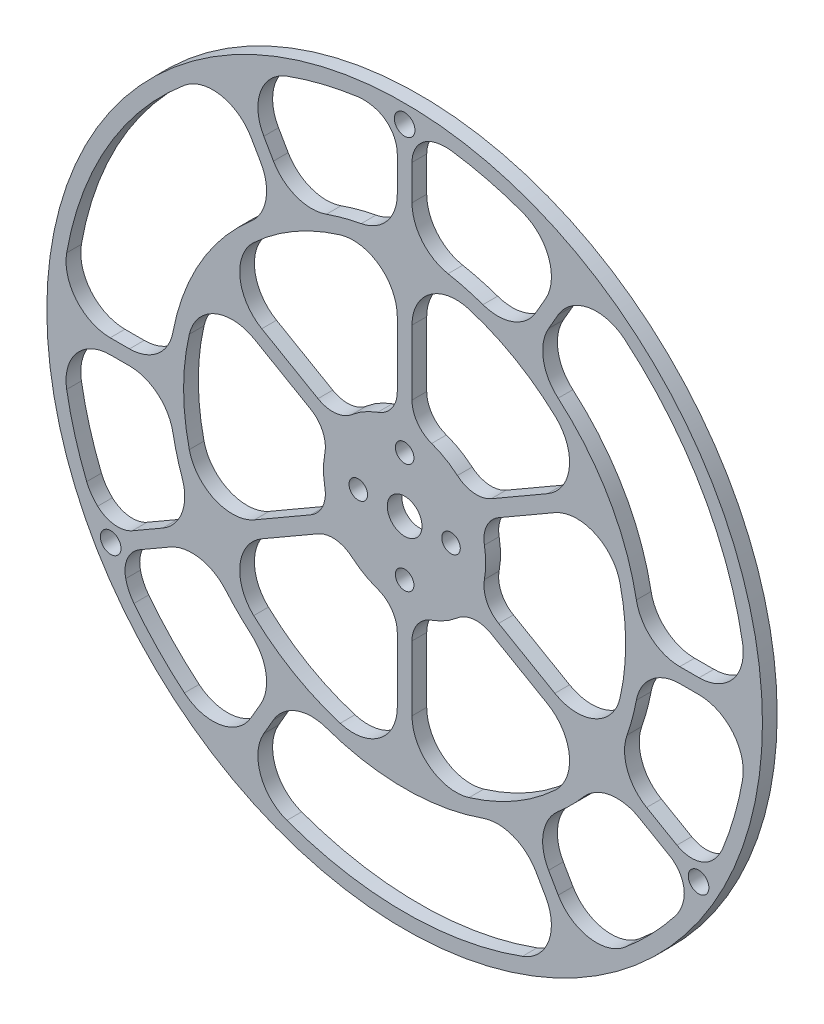
from build123d import *

# Parameters (mm, degrees)
SKETCH1_R               = 61.722
SKETCH1_R_2             = 59.182
SKETCH1_R_3             = 40.67
SKETCH1_R_4             = 38.13
SKETCH1_W               = 2.54
SKETCH1_H               = 25.4
EXTRUDE_THIN1_DEPTH     = 2.54
SKETCH1_14_R            = 1.778
SKETCH1_14_R_2          = 14
SKETCH1_14_R_3          = 3
SKETCH1_14_R_4          = 1.6
BOSS_EXTRUDE1_DEPTH     = 2.54
SKETCH2_W               = 2.54
SKETCH2_H               = 42.642
EXTRUDE_THIN3_DEPTH     = 2.54
CUT_EXTRUDE2_DEPTH      = 88.325037463
CUT_EXTRUDE2_DEPTH_BACK = 2.54
SKETCH1_16_R            = 1.778
FILLET1_DEPTH           = 2.54
SKETCH3_W               = 2.54
SKETCH3_H               = 3.122719577
BOSS_EXTRUDE2_DEPTH     = 2.54
FILLET2_R               = 5.08


with BuildPart() as part:
    # Sketch1 → Extrude-Thin1 (new body)
    # profile 1 of 13: a face of its own
    with BuildSketch(Plane.XY):
        Circle(SKETCH1_R)
        Circle(SKETCH1_R_2, mode=Mode.SUBTRACT)
    # profile 2 of 13: a face of its own
    with BuildSketch(Plane.XY):
        Circle(SKETCH1_R_3)
        Circle(SKETCH1_R_4, mode=Mode.SUBTRACT)
    # profile 3 of 13: a face of its own
    with BuildSketch(Plane.XY):
        Polygon((12.759355653, 5.900147737), (34.756400909, 18.600147737), (33.486400909, 20.799852263), (11.489355653, 8.099852263), align=None)
    # profile 4 of 13: a face of its own
    with BuildSketch(Plane.XY):
        with Locations((0, -26.7)):
            Rectangle(SKETCH1_W, SKETCH1_H)
    # profile 5 of 13: a face of its own
    with BuildSketch(Plane.XY):
        Polygon((-12.759355653, -5.900147737), (-49.688410921, -27.221147737), (-48.418410921, -29.420852263), (-11.489355653, -8.099852263), align=None)
    # profile 6 of 13: a face of its own
    with BuildSketch(Plane.XY):
        Polygon((-11.489355653, 8.099852263), (-33.486400909, 20.799852263), (-34.756400909, 18.600147737), (-12.759355653, 5.900147737), align=None)
    # profile 7 of 13: a face of its own
    with BuildSketch(Plane.XY):
        Polygon((20.804229626, 33.484213548), (31.32599957, 51.718222922), (29.12600043, 52.987712498), (18.604230486, 34.753703124), align=None)
    # profile 8 of 13: a face of its own
    with BuildSketch(Plane.XY):
        Polygon((39.400294371, -1.274884588), (60.452294674, -1.269999966), (60.451705326, 1.269999966), (39.399705024, 1.265115343), align=None)
    # profile 9 of 13: a face of its own
    with BuildSketch(Plane.XY):
        Polygon((18.596064745, -34.759098136), (29.126295104, -52.988222887), (31.325704896, -51.717712532), (20.795474538, -33.48858778), align=None)
    # profile 10 of 13: a face of its own
    with BuildSketch(Plane.XY):
        Polygon((-20.804229626, -33.484213548), (-31.32599957, -51.718222922), (-29.12600043, -52.987712498), (-18.604230486, -34.753703124), align=None)
    # profile 11 of 13: a face of its own
    with BuildSketch(Plane.XY):
        Polygon((-39.400294371, 1.274884588), (-60.452294674, 1.269999966), (-60.451705326, -1.269999966), (-39.399705024, -1.265115343), align=None)
    # profile 12 of 13: a face of its own
    with BuildSketch(Plane.XY):
        Polygon((-18.596064745, 34.759098136), (-29.126295104, 52.988222887), (-31.325704896, 51.717712532), (-20.795474538, 33.48858778), align=None)
    # profile 13 of 13: a face of its own
    with BuildSketch(Plane.XY):
        Polygon((11.489355653, -8.099852263), (48.418410921, -29.420852263), (49.688410921, -27.221147737), (12.759355653, -5.900147737), align=None)
    extrude(amount=EXTRUDE_THIN1_DEPTH)

    # Sketch1<14> → Boss-Extrude1 (add)
    # profile 1 of 4: a face of its own
    with BuildSketch(Plane.XY):
        with BuildLine():
            Line((-1.905, 60.421976788), (-1.905, 56.642))
            Line((-1.905, 56.642), (0, 56.642))
            Line((0, 56.642), (1.905, 56.642))
            Line((1.905, 56.642), (1.905, 60.421976788))
            ThreePointArc((1.905, 60.421976788), (0.952618286, 60.444493731), (0, 60.452))
            ThreePointArc((0, 60.452), (-0.952618286, 60.444493731), (-1.905, 60.421976788))
        make_face()
        with Locations((0, 58.547)):
            Circle(SKETCH1_14_R, mode=Mode.SUBTRACT)
    # profile 2 of 4: a face of its own
    with BuildSketch(Plane.XY):
        with BuildLine():
            ThreePointArc((52.352967448, -30.226000454), (52.822776105, -29.397255459), (53.279466845, -28.56121))
            Line((53.279466845, -28.56121), (50.005910921, -26.671221606))
            Line((50.005910921, -26.671221606), (49.053410921, -28.321))
            Line((49.053410921, -28.321), (48.100910921, -29.970778394))
            Line((48.100910921, -29.970778394), (51.374466845, -31.860766788))
            ThreePointArc((51.374466845, -31.860766788), (51.870157813, -31.047238726), (52.352967448, -30.226000454))
        make_face()
        with Locations((50.703189315, -29.2735)):
            Circle(SKETCH1_14_R, mode=Mode.SUBTRACT)
    # profile 3 of 4: a face of its own
    with BuildSketch(Plane.XY):
        with BuildLine():
            Line((-50.005910921, -26.671221606), (-53.279466845, -28.56121))
            ThreePointArc((-53.279466845, -28.56121), (-52.822776022, -29.397255609), (-52.352967276, -30.226000751))
            ThreePointArc((-52.352967276, -30.226000751), (-51.870157724, -31.047238873), (-51.374466845, -31.860766788))
            Line((-51.374466845, -31.860766788), (-48.100910921, -29.970778394))
            Line((-48.100910921, -29.970778394), (-49.053410921, -28.321))
            Line((-49.053410921, -28.321), (-50.005910921, -26.671221606))
        make_face()
        with Locations((-50.703189315, -29.2735)):
            Circle(SKETCH1_14_R, mode=Mode.SUBTRACT)
    # profile 4 of 4: a face of its own
    with BuildSketch(Plane.XY):
        Circle(SKETCH1_14_R_2)
        Circle(SKETCH1_14_R_3, mode=Mode.SUBTRACT)
        with Locations((-8, 0)):
            Circle(SKETCH1_14_R_4, mode=Mode.SUBTRACT)
        with Locations((8, 0)):
            Circle(SKETCH1_14_R_4, mode=Mode.SUBTRACT)
        with Locations((0, -9.5)):
            Circle(SKETCH1_14_R_4, mode=Mode.SUBTRACT)
        with Locations((0, 9.5)):
            Circle(SKETCH1_14_R_4, mode=Mode.SUBTRACT)
    extrude(amount=BOSS_EXTRUDE1_DEPTH)


with BuildPart() as boss_extrude1_piece_1:
    # of the separate pieces the step leaves, piece 1, a body of its own (boss_extrude1_pieces)
    add(part.part.solids().sort_by_distance((-34.569076469, -21.424935288, 0))[0])

    # Sketch2 → Extrude-Thin3 (add)
    with BuildSketch(Plane.XY.offset(2.54)):
        with Locations((0, 35.321)):
            Rectangle(SKETCH2_W, SKETCH2_H)
    extrude(amount=-EXTRUDE_THIN3_DEPTH)

    # Sketch1<16> → Cut-Extrude2 (cut, two sides: drawn at the far end of the back side and taken through both)
    with BuildSketch(Plane.XY.offset(-CUT_EXTRUDE2_DEPTH_BACK)):
        with Locations((0, 58.547)):
            Circle(SKETCH1_16_R)
        with Locations((-50.703189315, -29.2735)):
            Circle(SKETCH1_16_R)
        with Locations((50.703189315, -29.2735)):
            Circle(SKETCH1_16_R)
    extrude(amount=CUT_EXTRUDE2_DEPTH + CUT_EXTRUDE2_DEPTH_BACK, mode=Mode.SUBTRACT)

    # Fillet1: read off the stored shape, not the designer's step
    # Fillet1 outline → Fillet1 (add)
    with BuildSketch(Plane.XY):
        with BuildLine():
            Line((1.905, 59.151332183), (1.905, 56.642))
            ThreePointArc((1.905, 56.642), (4.805752754, 58.335784267), (8.1529572, 58.617731216))
            ThreePointArc((8.1529572, 58.617731216), (5.036050859, 58.967341095), (1.905, 59.151332183))
        make_face()
        with BuildLine():
            ThreePointArc((1.27, 53.596646983), (1.430439021, 55.152072969), (1.905, 56.642))
            Line((1.905, 56.642), (1.27, 56.642))
            Line((1.27, 56.642), (1.27, 53.596646983))
        make_face()
        with BuildLine():
            ThreePointArc((28.484594746, 51.876169733), (24.46951302, 53.886473781), (20.313572473, 55.586580192))
            ThreePointArc((20.313572473, 55.586580192), (24.859936107, 51.031888542), (24.298088458, 44.621041053))
            Line((24.298088458, 44.621041053), (28.484594746, 51.876169733))
        make_face()
        with BuildLine():
            ThreePointArc((7.487187824, 39.974878593), (3.026817043, 42.597660365), (1.27, 47.46463947))
            Line((1.27, 47.46463947), (1.27, 40.650166051))
            ThreePointArc((1.27, 40.650166051), (4.39159287, 40.432200188), (7.487187824, 39.974878593))
        make_face()
        with BuildLine():
            Line((19.229281343, 35.836903313), (22.636242804, 41.741096956))
            ThreePointArc((22.636242804, 41.741096956), (18.681023473, 38.40326952), (13.50577966, 38.361997026))
            ThreePointArc((13.50577966, 38.361997026), (16.416152999, 37.209660315), (19.229281343, 35.836903313))
        make_face()
        with BuildLine():
            ThreePointArc((-1.905, 59.151332183), (-5.036050859, 58.967341094), (-8.1529572, 58.617731216))
            ThreePointArc((-8.1529572, 58.617731216), (-4.805752754, 58.335784267), (-1.905, 56.642))
            Line((-1.905, 56.642), (-1.905, 59.151332183))
        make_face()
        with BuildLine():
            Line((-1.27, 56.642), (-1.905, 56.642))
            ThreePointArc((-1.905, 56.642), (-1.430439021, 55.152072969), (-1.27, 53.596646983))
            Line((-1.27, 53.596646983), (-1.27, 56.642))
        make_face()
        with BuildLine():
            ThreePointArc((-24.292044963, 44.619540923), (-24.856149478, 51.032105093), (-20.308665179, 55.588373269))
            ThreePointArc((-20.308665179, 55.588373269), (-24.466863178, 53.887676979), (-28.484072487, 51.876456496))
            Line((-28.484072487, 51.876456496), (-24.292044963, 44.619540923))
        make_face()
        with BuildLine():
            Line((-1.27, 40.650166051), (-1.27, 47.46463947))
            ThreePointArc((-1.27, 47.46463947), (-3.026817043, 42.597660365), (-7.487187824, 39.974878593))
            ThreePointArc((-7.487187824, 39.974878593), (-4.39159287, 40.432200188), (-1.27, 40.650166051))
        make_face()
        with BuildLine():
            ThreePointArc((-13.500908535, 38.363711613), (-18.674035219, 38.404859709), (-22.628690975, 41.740070453))
            Line((-22.628690975, 41.740070453), (-19.221179804, 35.841249238))
            ThreePointArc((-19.221179804, 35.841249238), (-16.409584712, 37.212557418), (-13.500908535, 38.363711613))
        make_face()
        with BuildLine():
            Line((50.274056338, -31.225444486), (48.100910921, -29.970778394))
            ThreePointArc((48.100910921, -29.970778394), (48.117394748, -33.329796103), (46.687965745, -36.369533659))
            ThreePointArc((46.687965745, -36.369533659), (48.549189952, -33.845018526), (50.274056338, -31.225444486))
        make_face()
        with BuildLine():
            ThreePointArc((45.781057845, -27.898175754), (47.047876752, -28.814833015), (48.100910921, -29.970778394))
            Line((48.100910921, -29.970778394), (48.418410921, -29.420852263))
            Line((48.418410921, -29.420852263), (45.781057845, -27.898175754))
        make_face()
        with BuildLine():
            ThreePointArc((30.875666463, -26.471534154), (35.377247497, -23.920130634), (40.470583562, -24.832171998))
            Line((40.470583562, -24.832171998), (34.569076468, -21.424935288))
            ThreePointArc((34.569076468, -21.424935288), (32.819516059, -24.019331082), (30.875666463, -26.471534154))
        make_face()
        with BuildLine():
            ThreePointArc((30.683783467, -50.606467533), (34.432298705, -48.134456784), (37.982604319, -45.385359899))
            ThreePointArc((37.982604319, -45.385359899), (31.764943827, -47.045280476), (26.493910866, -43.353282395))
            Line((26.493910866, -43.353282395), (30.683783467, -50.606467533))
        make_face()
        with BuildLine():
            ThreePointArc((24.830728943, -40.474109792), (23.917695256, -35.379875656), (26.469574134, -30.877346796))
            ThreePointArc((26.469574134, -30.877346796), (24.016434599, -32.821635687), (21.42102799, -34.571497796))
            Line((21.42102799, -34.571497796), (24.830728943, -40.474109792))
        make_face()
        with BuildLine():
            ThreePointArc((52.179056338, -27.925887697), (53.585240811, -25.122322568), (54.840922945, -22.248197557))
            ThreePointArc((54.840922945, -22.248197557), (52.923147502, -25.005988165), (50.005910921, -26.671221606))
            Line((50.005910921, -26.671221606), (52.179056338, -27.925887697))
        make_face()
        with BuildLine():
            Line((49.688410921, -27.221147737), (50.005910921, -26.671221606))
            ThreePointArc((50.005910921, -26.671221606), (48.478315773, -26.337239954), (47.051057845, -25.698471229))
            Line((47.051057845, -25.698471229), (49.688410921, -27.221147737))
        make_face()
        with BuildLine():
            ThreePointArc((50.787678426, -1.272242413), (56.623174158, -3.989995658), (58.295275995, -10.206366672))
            ThreePointArc((58.295275995, -10.206366672), (58.901528804, -5.754913427), (59.168365427, -1.270297871))
            Line((59.168365427, -1.270297871), (50.787678426, -1.272242413))
        make_face()
        with BuildLine():
            Line((35.839076468, -19.225230763), (41.740583562, -22.632467472))
            ThreePointArc((41.740583562, -22.632467472), (38.404064539, -18.677529731), (38.362854286, -13.503344438))
            ThreePointArc((38.362854286, -13.503344438), (37.211108929, -16.412869106), (35.839076468, -19.225230763))
        make_face()
        with BuildLine():
            ThreePointArc((39.974403108, -7.489726041), (42.596601746, -3.030240964), (47.462306855, -1.273013987))
            Line((47.462306855, -1.273013987), (40.650022245, -1.274594618))
            ThreePointArc((40.650022245, -1.274594618), (40.431812419, -4.395161483), (39.974403108, -7.489726041))
        make_face()
        with BuildLine():
            Line((-52.179056338, -27.925887697), (-50.005910921, -26.671221606))
            ThreePointArc((-50.005910921, -26.671221606), (-52.923147502, -25.005988165), (-54.840922945, -22.248197557))
            ThreePointArc((-54.840922945, -22.248197557), (-53.585240811, -25.122322568), (-52.179056338, -27.925887697))
        make_face()
        with BuildLine():
            ThreePointArc((-47.051057845, -25.698471229), (-48.478315773, -26.337239954), (-50.005910921, -26.671221606))
            Line((-50.005910921, -26.671221606), (-49.688410921, -27.221147737))
            Line((-49.688410921, -27.221147737), (-47.051057845, -25.698471229))
        make_face()
        with BuildLine():
            ThreePointArc((-59.168378213, -1.2697022), (-58.901811725, -5.752016997), (-58.296176791, -10.201220293))
            ThreePointArc((-58.296176791, -10.201220293), (-56.624879934, -3.986608066), (-50.791999324, -1.267758658))
            Line((-50.791999324, -1.267758658), (-59.168378213, -1.2697022))
        make_face()
        with BuildLine():
            ThreePointArc((-38.362854286, -13.503344438), (-38.404064539, -18.677529731), (-41.740583562, -22.632467472))
            Line((-41.740583562, -22.632467472), (-35.839076469, -19.225230763))
            ThreePointArc((-35.839076469, -19.225230763), (-37.211108929, -16.412869106), (-38.362854286, -13.503344438))
        make_face()
        with BuildLine():
            Line((-40.650309333, -1.265405517), (-47.466971748, -1.266987163))
            ThreePointArc((-47.466971748, -1.266987163), (-42.598718729, -3.023393864), (-39.975353794, -7.48465023))
            ThreePointArc((-39.975353794, -7.48465023), (-40.432587598, -4.388024628), (-40.650309333, -1.265405517))
        make_face()
        with BuildLine():
            ThreePointArc((-50.274056338, -31.225444486), (-48.549189952, -33.845018526), (-46.687965745, -36.369533659))
            ThreePointArc((-46.687965745, -36.369533659), (-48.117394748, -33.329796103), (-48.100910921, -29.970778394))
            Line((-48.100910921, -29.970778394), (-50.274056338, -31.225444486))
        make_face()
        with BuildLine():
            Line((-48.418410921, -29.420852263), (-48.100910921, -29.970778394))
            ThreePointArc((-48.100910921, -29.970778394), (-47.047876752, -28.814833015), (-45.781057845, -27.898175754))
            Line((-45.781057845, -27.898175754), (-48.418410921, -29.420852263))
        make_face()
        with BuildLine():
            ThreePointArc((-26.495633462, -43.347298509), (-31.767024679, -47.042109435), (-37.986610816, -45.382006596))
            ThreePointArc((-37.986610816, -45.382006596), (-34.434665626, -48.132763553), (-30.684292941, -50.606158625))
            Line((-30.684292941, -50.606158625), (-26.495633462, -43.347298509))
        make_face()
        with BuildLine():
            Line((-34.569076469, -21.424935288), (-40.470583562, -24.832171998))
            ThreePointArc((-40.470583562, -24.832171998), (-35.377247497, -23.920130634), (-30.875666463, -26.471534154))
            ThreePointArc((-30.875666463, -26.471534154), (-32.81951606, -24.019331082), (-34.569076469, -21.424935288))
        make_face()
        with BuildLine():
            ThreePointArc((-26.473494573, -30.873985572), (-23.922566527, -35.374618745), (-24.83361588, -40.467056465))
            Line((-24.83361588, -40.467056465), (-21.428842442, -34.56665462))
            ThreePointArc((-21.428842442, -34.56665462), (-24.022227708, -32.817395935), (-26.473494573, -30.873985572))
        make_face()
        with BuildLine():
            ThreePointArc((-40.650022245, 1.274594618), (-40.431812419, 4.395161483), (-39.974403108, 7.489726041))
            ThreePointArc((-39.974403108, 7.489726041), (-42.596601746, 3.030240964), (-47.462306855, 1.273013987))
            Line((-47.462306855, 1.273013987), (-40.650022245, 1.274594618))
        make_face()
        with BuildLine():
            ThreePointArc((-24.830728943, 40.474109792), (-23.917695256, 35.379875656), (-26.469574134, 30.877346796))
            ThreePointArc((-26.469574134, 30.877346796), (-24.016434599, 32.821635687), (-21.42102799, 34.571497796))
            Line((-21.42102799, 34.571497796), (-24.830728943, 40.474109792))
        make_face()
        with BuildLine():
            Line((-59.168365427, 1.270297871), (-50.787678426, 1.272242413))
            ThreePointArc((-50.787678426, 1.272242413), (-56.623174158, 3.989995658), (-58.295275995, 10.206366672))
            ThreePointArc((-58.295275995, 10.206366672), (-58.901528804, 5.754913427), (-59.168365427, 1.270297871))
        make_face()
        with BuildLine():
            ThreePointArc((-37.982604319, 45.385359899), (-31.764943827, 47.045280476), (-26.493910866, 43.353282395))
            Line((-26.493910866, 43.353282395), (-30.683783467, 50.606467533))
            ThreePointArc((-30.683783467, 50.606467533), (-34.432298705, 48.134456784), (-37.982604319, 45.385359899))
        make_face()
        with BuildLine():
            ThreePointArc((-28.484594746, -51.876169733), (-24.46951302, -53.886473781), (-20.313572473, -55.586580191))
            ThreePointArc((-20.313572473, -55.586580191), (-24.859936107, -51.031888542), (-24.298088458, -44.621041053))
            Line((-24.298088458, -44.621041053), (-28.484594746, -51.876169733))
        make_face()
        with BuildLine():
            ThreePointArc((24.292044963, -44.619540923), (24.856149478, -51.032105093), (20.308665179, -55.588373269))
            ThreePointArc((20.308665179, -55.588373269), (24.466863178, -53.88767698), (28.484072487, -51.876456496))
            Line((28.484072487, -51.876456496), (24.292044963, -44.619540923))
        make_face()
        with BuildLine():
            Line((-19.229281343, -35.836903313), (-22.636242804, -41.741096956))
            ThreePointArc((-22.636242804, -41.741096956), (-18.681023473, -38.40326952), (-13.50577966, -38.361997026))
            ThreePointArc((-13.50577966, -38.361997026), (-16.416152999, -37.209660315), (-19.229281343, -35.836903313))
        make_face()
        with BuildLine():
            ThreePointArc((13.500908535, -38.363711613), (18.674035219, -38.404859709), (22.628690975, -41.740070453))
            Line((22.628690975, -41.740070453), (19.221179804, -35.841249238))
            ThreePointArc((19.221179804, -35.841249238), (16.409584712, -37.212557418), (13.500908535, -38.363711613))
        make_face()
        with BuildLine():
            ThreePointArc((59.168378213, 1.2697022), (58.901811725, 5.752016998), (58.296176792, 10.201220293))
            ThreePointArc((58.296176792, 10.201220293), (56.624879934, 3.986608066), (50.791999324, 1.267758658))
            Line((50.791999324, 1.267758658), (59.168378213, 1.2697022))
        make_face()
        with BuildLine():
            ThreePointArc((26.495633462, 43.347298509), (31.767024679, 47.042109435), (37.986610816, 45.382006596))
            ThreePointArc((37.986610816, 45.382006596), (34.434665627, 48.132763553), (30.684292941, 50.606158625))
            Line((30.684292941, 50.606158625), (26.495633462, 43.347298509))
        make_face()
        with BuildLine():
            Line((40.650309333, 1.265405517), (47.466971748, 1.266987163))
            ThreePointArc((47.466971748, 1.266987163), (42.598718729, 3.023393864), (39.975353794, 7.48465023))
            ThreePointArc((39.975353794, 7.48465023), (40.432587598, 4.388024628), (40.650309333, 1.265405517))
        make_face()
        with BuildLine():
            ThreePointArc((26.473494573, 30.873985572), (23.922566527, 35.374618745), (24.83361588, 40.467056465))
            Line((24.83361588, 40.467056465), (21.428842442, 34.56665462))
            ThreePointArc((21.428842442, 34.56665462), (24.022227708, 32.817395935), (26.473494573, 30.873985572))
        make_face()
        with BuildLine():
            Line((-33.638227115, -17.954569796), (-25.91089761, -13.493194026))
            ThreePointArc((-25.91089761, -13.493194026), (-32.755741888, -13.883652698), (-37.143815991, -8.615905852))
            ThreePointArc((-37.143815991, -8.615905852), (-35.697717961, -13.400366875), (-33.638227115, -17.954569796))
        make_face()
        with BuildLine():
            ThreePointArc((-33.638227115, 17.954569796), (-35.697717961, 13.400366875), (-37.143815991, 8.615905852))
            ThreePointArc((-37.143815991, 8.615905852), (-32.755741888, 13.883652698), (-25.91089761, 13.493194026))
            Line((-25.91089761, 13.493194026), (-33.638227115, 17.954569796))
        make_face()
        with BuildLine():
            ThreePointArc((-32.368227115, -20.154274322), (-29.453917114, -24.214947174), (-26.03350134, -27.859535315))
            ThreePointArc((-26.03350134, -27.859535315), (-28.401466877, -21.425478246), (-24.64089761, -15.692898552))
            Line((-24.64089761, -15.692898552), (-32.368227115, -20.154274322))
        make_face()
        with BuildLine():
            ThreePointArc((-1.27, -29.186092578), (-4.35427501, -35.309130943), (-11.110314651, -36.475441167))
            ThreePointArc((-11.110314651, -36.475441167), (-6.243800847, -37.615314049), (-1.27, -38.108844118))
            Line((-1.27, -38.108844118), (-1.27, -29.186092578))
        make_face()
        with BuildLine():
            ThreePointArc((1.27, -38.108844118), (6.243800847, -37.615314049), (11.110314651, -36.475441167))
            ThreePointArc((11.110314651, -36.475441167), (4.35427501, -35.309130943), (1.27, -29.186092578))
            Line((1.27, -29.186092578), (1.27, -38.108844118))
        make_face()
        with BuildLine():
            ThreePointArc((24.64089761, -15.692898552), (28.401466877, -21.425478246), (26.03350134, -27.859535315))
            ThreePointArc((26.03350134, -27.859535315), (29.453917114, -24.214947174), (32.368227115, -20.154274322))
            Line((32.368227115, -20.154274322), (24.64089761, -15.692898552))
        make_face()
        with BuildLine():
            ThreePointArc((33.638227115, -17.954569796), (35.697717961, -13.400366875), (37.143815991, -8.615905852))
            ThreePointArc((37.143815991, -8.615905852), (32.755741888, -13.883652698), (25.91089761, -13.493194026))
            Line((25.91089761, -13.493194026), (33.638227115, -17.954569796))
        make_face()
        with BuildLine():
            ThreePointArc((25.91089761, 13.493194026), (32.755741888, 13.883652698), (37.143815991, 8.615905852))
            ThreePointArc((37.143815991, 8.615905852), (35.697717961, 13.400366875), (33.638227115, 17.954569796))
            Line((33.638227115, 17.954569796), (25.91089761, 13.493194026))
        make_face()
        with BuildLine():
            ThreePointArc((32.368227115, 20.154274322), (29.453917114, 24.214947174), (26.03350134, 27.859535315))
            ThreePointArc((26.03350134, 27.859535315), (28.401466877, 21.425478246), (24.64089761, 15.692898552))
            Line((24.64089761, 15.692898552), (32.368227115, 20.154274322))
        make_face()
        with BuildLine():
            ThreePointArc((1.27, 29.186092578), (4.35427501, 35.309130943), (11.110314651, 36.475441167))
            ThreePointArc((11.110314651, 36.475441167), (6.243800847, 37.615314049), (1.27, 38.108844118))
            Line((1.27, 38.108844118), (1.27, 29.186092578))
        make_face()
        with BuildLine():
            Line((-32.368227115, 20.154274322), (-24.64089761, 15.692898552))
            ThreePointArc((-24.64089761, 15.692898552), (-28.401466877, 21.425478246), (-26.03350134, 27.859535315))
            ThreePointArc((-26.03350134, 27.859535315), (-29.453917114, 24.214947174), (-32.368227115, 20.154274322))
        make_face()
        with BuildLine():
            ThreePointArc((-1.27, 38.108844118), (-6.243800847, 37.615314049), (-11.110314651, 36.475441167))
            ThreePointArc((-11.110314651, 36.475441167), (-4.35427501, 35.309130943), (-1.27, 29.186092578))
            Line((-1.27, 29.186092578), (-1.27, 38.108844118))
        make_face()
    extrude(amount=FILLET1_DEPTH)



with BuildPart() as boss_extrude1_piece_2:
    # of the separate pieces the step leaves, piece 2, a body of its own (boss_extrude1_pieces)
    add(part.part.solids().sort_by_distance((3, 0, 0))[0])


with BuildPart() as boss_extrude1_piece_1_1:
    add(boss_extrude1_piece_1.part)

    add(boss_extrude1_piece_2.part)  # Boss-Extrude2 merges Boss-Extrude1 piece 2
    # Sketch3 → Boss-Extrude2 (add)
    with BuildSketch(Plane.XY.offset(2.54)):
        with Locations((0, 13.759716534)):
            Rectangle(SKETCH3_W, SKETCH3_H)
        Polygon((12.633441308, 8.760390424), (13.903441308, 6.560685898), (11.199086825, 4.99932611), (9.929086825, 7.199030635), align=None)
        Polygon((13.903441308, -6.560685898), (12.633441308, -8.760390424), (9.929086825, -7.199030635), (11.199086825, -4.99932611), align=None)
        with Locations((0, -13.759716534)):
            Rectangle(SKETCH3_W, SKETCH3_H)
        Polygon((-12.633441308, -8.760390424), (-13.903441308, -6.560685898), (-11.199086825, -4.99932611), (-9.929086825, -7.199030635), align=None)
        Polygon((-13.903441308, 6.560685898), (-12.633441308, 8.760390424), (-9.929086825, 7.199030635), (-11.199086825, 4.99932611), align=None)
    extrude(amount=-BOSS_EXTRUDE2_DEPTH)

    # Fillet2
    fillet2_edges = [boss_extrude1_piece_1_1.edges().sort_by_distance(p)[0] for p in [
        (1.27, -13.942277432, 1.27),
        (-1.27, -13.942277432, 1.27),
        (-12.709366443, -5.871286453, 1.27),
        (-11.439366443, -8.070990979, 1.27),
        (-11.439366443, 8.070990979, 1.27),
        (-12.709366443, 5.871286453, 1.27),
        (-1.27, 13.942277432, 1.27),
        (1.27, 13.942277432, 1.27),
        (11.439366443, -8.070990979, 1.27),
        (12.709366443, -5.871286453, 1.27),
        (12.709366443, 5.871286453, 1.27),
        (11.439366443, 8.070990979, 1.27),
        (48.100910921, -29.970778394, 1.27),
        (50.005910921, -26.671221606, 1.27),
        (1.905, 56.642, 1.27),
        (-1.905, 56.642, 1.27),
        (-50.005910921, -26.671221606, 1.27),
        (-48.100910921, -29.970778394, 1.27),
    ]]
    fillet(fillet2_edges, radius=FILLET2_R)


solid = boss_extrude1_piece_1_1.part
